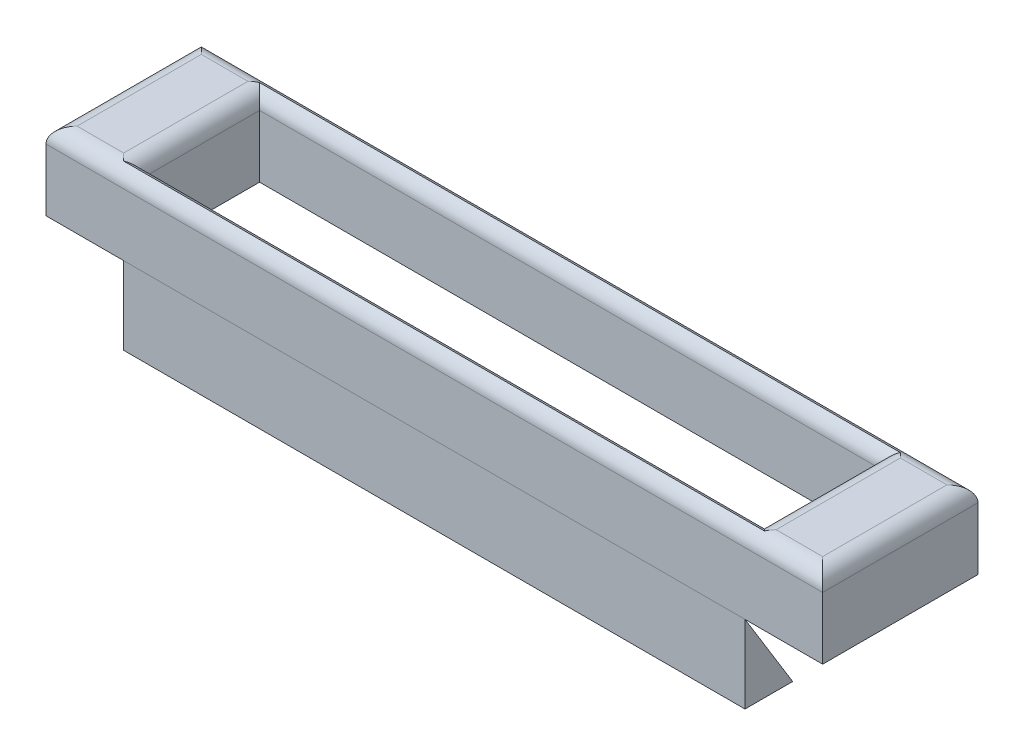
from build123d import *

# Parameters (mm, degrees)
BOSS_EXTRUDE1_DEPTH      = 10
BOSS_EXTRUDE1_DEPTH_BACK = 10
SKETCH1_W                = 100
SKETCH1_H                = 20
CUT_EXTRUDE1_DEPTH       = 100
SKETCH3_W                = 80
SKETCH3_H                = 15
CUT_EXTRUDE2_DEPTH       = 10
FILLET3_R                = 2
CUT_EXTRUDE4_DEPTH       = 10
CUT_EXTRUDE5_DEPTH       = 10
CUT_EXTRUDE6_DEPTH       = 80


with BuildPart() as part:
    # Sketch1 → Boss-Extrude1 (new, two sides: drawn at the far end of the back side and taken through both)
    with BuildSketch(Plane(origin=(0, 0, 0), x_dir=(1, 0, 0), z_dir=(0, 1, 0)).offset(-BOSS_EXTRUDE1_DEPTH_BACK)):
        with Locations((0, 8.804664723)):
            Rectangle(SKETCH1_W, SKETCH1_H)
    extrude(amount=BOSS_EXTRUDE1_DEPTH + BOSS_EXTRUDE1_DEPTH_BACK)

    # Sketch2 → Cut-Extrude1 (cut)
    with BuildSketch(Plane(origin=(50, 0, 0), x_dir=(0, 0, -1), z_dir=(1, 0, 0))):
        Polygon((-1.195335277, 0), (18.804664723, 0), (18.804664723, -10), align=None)
    extrude(amount=-CUT_EXTRUDE1_DEPTH, mode=Mode.SUBTRACT)


with BuildPart() as cut_extrude1_piece_1:
    # of the separate pieces the step leaves, piece 1, a body of its own (cut_extrude1_pieces)
    add(part.part.solids().sort_by_distance((-50, 10, 1.195335277))[0])

    # Sketch3 → Cut-Extrude2 (cut)
    with BuildSketch(Plane(origin=(0, 10, 0), x_dir=(1, 0, 0), z_dir=(0, 1, 0))):
        with Locations((0, 8.804664723)):
            Rectangle(SKETCH3_W, SKETCH3_H)
    extrude(amount=-CUT_EXTRUDE2_DEPTH, mode=Mode.SUBTRACT)

    # Fillet3
    # the kernel refuses this fillet: 2 mm, written as the material it takes off along each edge
    with BuildSketch(Plane(origin=(40, 10, -16.304664723), x_dir=(1, 0, 0), z_dir=(0, 0, 1)), Plane(origin=(-40, 10, -1.304664723), x_dir=(-1, 0, 0), z_dir=(0, 0, -1))) as fillet3_piece_1:
        with BuildLine():
            CenterArc((FILLET3_R, -FILLET3_R), FILLET3_R, 90, 90)
            Line((0, -FILLET3_R), (-FILLET3_R * 0.02, -FILLET3_R))
            Line((-FILLET3_R * 0.02, -FILLET3_R), (-FILLET3_R * 0.02, FILLET3_R * 0.02))
            Line((-FILLET3_R * 0.02, FILLET3_R * 0.02), (FILLET3_R, FILLET3_R * 0.02))
            Line((FILLET3_R, FILLET3_R * 0.02), (FILLET3_R, 0))
        make_face()
    extrude(amount=15, mode=Mode.SUBTRACT)
    with BuildSketch(Plane(origin=(-40, 10, -16.304664723), x_dir=(0, 0, -1), z_dir=(1, 0, 0)), Plane(origin=(40, 10, -1.304664723), x_dir=(0, 0, 1), z_dir=(-1, 0, 0))) as fillet3_piece_2:
        with BuildLine():
            CenterArc((FILLET3_R, -FILLET3_R), FILLET3_R, 90, 90)
            Line((0, -FILLET3_R), (-FILLET3_R * 0.02, -FILLET3_R))
            Line((-FILLET3_R * 0.02, -FILLET3_R), (-FILLET3_R * 0.02, FILLET3_R * 0.02))
            Line((-FILLET3_R * 0.02, FILLET3_R * 0.02), (FILLET3_R, FILLET3_R * 0.02))
            Line((FILLET3_R, FILLET3_R * 0.02), (FILLET3_R, 0))
        make_face()
    extrude(amount=80, mode=Mode.SUBTRACT)
    with BuildSketch(Plane(origin=(50, 10, 1.195335277), x_dir=(0, -1, 0), z_dir=(0, 0, -1)), Plane(origin=(-50, 10, -18.804664723), x_dir=(0, -1, 0), z_dir=(0, 0, 1))) as fillet3_piece_3:
        with BuildLine():
            CenterArc((FILLET3_R, FILLET3_R), FILLET3_R, 180, 90)
            Line((0, FILLET3_R), (-FILLET3_R * 0.02, FILLET3_R))
            Line((-FILLET3_R * 0.02, FILLET3_R), (-FILLET3_R * 0.02, -FILLET3_R * 0.02))
            Line((-FILLET3_R * 0.02, -FILLET3_R * 0.02), (FILLET3_R, -FILLET3_R * 0.02))
            Line((FILLET3_R, -FILLET3_R * 0.02), (FILLET3_R, 0))
        make_face()
    extrude(amount=20, mode=Mode.SUBTRACT)
    with BuildSketch(Plane(origin=(50, 10, -18.804664723), x_dir=(0, 0, 1), z_dir=(-1, 0, 0))) as fillet3_piece_4:
        with BuildLine():
            CenterArc((FILLET3_R, -FILLET3_R), FILLET3_R, 90, 90)
            Line((0, -FILLET3_R), (-FILLET3_R * 0.02, -FILLET3_R))
            Line((-FILLET3_R * 0.02, -FILLET3_R), (-FILLET3_R * 0.02, FILLET3_R * 0.02))
            Line((-FILLET3_R * 0.02, FILLET3_R * 0.02), (FILLET3_R, FILLET3_R * 0.02))
            Line((FILLET3_R, FILLET3_R * 0.02), (FILLET3_R, 0))
        make_face()
    extrude(amount=100, mode=Mode.SUBTRACT)
    with BuildSketch(Plane(origin=(-50, 10, 1.195335277), x_dir=(0, -1, 0), z_dir=(1, 0, 0))) as fillet3_piece_5:
        with BuildLine():
            CenterArc((FILLET3_R, FILLET3_R), FILLET3_R, 180, 90)
            Line((0, FILLET3_R), (-FILLET3_R * 0.02, FILLET3_R))
            Line((-FILLET3_R * 0.02, FILLET3_R), (-FILLET3_R * 0.02, -FILLET3_R * 0.02))
            Line((-FILLET3_R * 0.02, -FILLET3_R * 0.02), (FILLET3_R, -FILLET3_R * 0.02))
            Line((FILLET3_R, -FILLET3_R * 0.02), (FILLET3_R, 0))
        make_face()
    extrude(amount=100, mode=Mode.SUBTRACT)
    with BuildSketch(Plane(origin=(40, 10, -21.304664723), x_dir=(1, 0, 0), z_dir=(0, 0, 1))) as fillet3_piece_6a_section:
        with BuildLine():
            CenterArc((FILLET3_R, -FILLET3_R), FILLET3_R, 90, 90)
            Line((0, -FILLET3_R), (-FILLET3_R * 0.02, -FILLET3_R))
            Line((-FILLET3_R * 0.02, -FILLET3_R), (-FILLET3_R * 0.02, FILLET3_R * 0.02))
            Line((-FILLET3_R * 0.02, FILLET3_R * 0.02), (FILLET3_R, FILLET3_R * 0.02))
            Line((FILLET3_R, FILLET3_R * 0.02), (FILLET3_R, 0))
        make_face()
    fillet3_piece_6a = extrude(amount=20, mode=Mode.PRIVATE)
    fillet3_piece_6a = split(fillet3_piece_6a, bisect_by=Plane(origin=(40.452790229, 9.547209771, -16.304664723), z_dir=(0, 0, -1)), keep=Keep.TOP, mode=Mode.PRIVATE)
    with BuildSketch(Plane(origin=(-40, 10, -16.304664723), x_dir=(0, 0, -1), z_dir=(1, 0, 0))) as fillet3_piece_6b_section:
        with BuildLine():
            CenterArc((FILLET3_R, -FILLET3_R), FILLET3_R, 90, 90)
            Line((0, -FILLET3_R), (-FILLET3_R * 0.02, -FILLET3_R))
            Line((-FILLET3_R * 0.02, -FILLET3_R), (-FILLET3_R * 0.02, FILLET3_R * 0.02))
            Line((-FILLET3_R * 0.02, FILLET3_R * 0.02), (FILLET3_R, FILLET3_R * 0.02))
            Line((FILLET3_R, FILLET3_R * 0.02), (FILLET3_R, 0))
        make_face()
    fillet3_piece_6b = extrude(amount=85, mode=Mode.PRIVATE)
    fillet3_piece_6b = split(fillet3_piece_6b, bisect_by=Plane(origin=(40, 9.547209771, -16.757454952), z_dir=(1, 0, 0)), keep=Keep.TOP, mode=Mode.PRIVATE)
    fillet3_piece_6 = fillet3_piece_6a & fillet3_piece_6b
    add(fillet3_piece_6, mode=Mode.SUBTRACT)
    with BuildSketch(Plane(origin=(45, 10, -1.304664723), x_dir=(0, 0, 1), z_dir=(-1, 0, 0))) as fillet3_piece_7a_section:
        with BuildLine():
            CenterArc((FILLET3_R, -FILLET3_R), FILLET3_R, 90, 90)
            Line((0, -FILLET3_R), (-FILLET3_R * 0.02, -FILLET3_R))
            Line((-FILLET3_R * 0.02, -FILLET3_R), (-FILLET3_R * 0.02, FILLET3_R * 0.02))
            Line((-FILLET3_R * 0.02, FILLET3_R * 0.02), (FILLET3_R, FILLET3_R * 0.02))
            Line((FILLET3_R, FILLET3_R * 0.02), (FILLET3_R, 0))
        make_face()
    fillet3_piece_7a = extrude(amount=85, mode=Mode.PRIVATE)
    fillet3_piece_7a = split(fillet3_piece_7a, bisect_by=Plane(origin=(40, 9.547209771, -0.851874494), z_dir=(1, 0, 0)), keep=Keep.TOP, mode=Mode.PRIVATE)
    with BuildSketch(Plane(origin=(40, 10, -16.304664723), x_dir=(1, 0, 0), z_dir=(0, 0, 1))) as fillet3_piece_7b_section:
        with BuildLine():
            CenterArc((FILLET3_R, -FILLET3_R), FILLET3_R, 90, 90)
            Line((0, -FILLET3_R), (-FILLET3_R * 0.02, -FILLET3_R))
            Line((-FILLET3_R * 0.02, -FILLET3_R), (-FILLET3_R * 0.02, FILLET3_R * 0.02))
            Line((-FILLET3_R * 0.02, FILLET3_R * 0.02), (FILLET3_R, FILLET3_R * 0.02))
            Line((FILLET3_R, FILLET3_R * 0.02), (FILLET3_R, 0))
        make_face()
    fillet3_piece_7b = extrude(amount=20, mode=Mode.PRIVATE)
    fillet3_piece_7b = split(fillet3_piece_7b, bisect_by=Plane(origin=(40.452790229, 9.547209771, -1.304664723), z_dir=(0, 0, 1)), keep=Keep.TOP, mode=Mode.PRIVATE)
    fillet3_piece_7 = fillet3_piece_7a & fillet3_piece_7b
    add(fillet3_piece_7, mode=Mode.SUBTRACT)
    with BuildSketch(Plane(origin=(-40, 10, -1.304664723), x_dir=(-1, 0, 0), z_dir=(0, 0, -1))) as fillet3_piece_8a_section:
        with BuildLine():
            CenterArc((FILLET3_R, -FILLET3_R), FILLET3_R, 90, 90)
            Line((0, -FILLET3_R), (-FILLET3_R * 0.02, -FILLET3_R))
            Line((-FILLET3_R * 0.02, -FILLET3_R), (-FILLET3_R * 0.02, FILLET3_R * 0.02))
            Line((-FILLET3_R * 0.02, FILLET3_R * 0.02), (FILLET3_R, FILLET3_R * 0.02))
            Line((FILLET3_R, FILLET3_R * 0.02), (FILLET3_R, 0))
        make_face()
    fillet3_piece_8a = extrude(amount=20, mode=Mode.PRIVATE)
    fillet3_piece_8a = split(fillet3_piece_8a, bisect_by=Plane(origin=(-40.452790229, 9.547209771, -16.304664723), z_dir=(0, 0, -1)), keep=Keep.TOP, mode=Mode.PRIVATE)
    with BuildSketch(Plane(origin=(-45, 10, -16.304664723), x_dir=(0, 0, -1), z_dir=(1, 0, 0))) as fillet3_piece_8b_section:
        with BuildLine():
            CenterArc((FILLET3_R, -FILLET3_R), FILLET3_R, 90, 90)
            Line((0, -FILLET3_R), (-FILLET3_R * 0.02, -FILLET3_R))
            Line((-FILLET3_R * 0.02, -FILLET3_R), (-FILLET3_R * 0.02, FILLET3_R * 0.02))
            Line((-FILLET3_R * 0.02, FILLET3_R * 0.02), (FILLET3_R, FILLET3_R * 0.02))
            Line((FILLET3_R, FILLET3_R * 0.02), (FILLET3_R, 0))
        make_face()
    fillet3_piece_8b = extrude(amount=85, mode=Mode.PRIVATE)
    fillet3_piece_8b = split(fillet3_piece_8b, bisect_by=Plane(origin=(-40, 9.547209771, -16.757454952), z_dir=(-1, 0, 0)), keep=Keep.TOP, mode=Mode.PRIVATE)
    fillet3_piece_8 = fillet3_piece_8a & fillet3_piece_8b
    add(fillet3_piece_8, mode=Mode.SUBTRACT)
    with BuildSketch(Plane(origin=(-40, 10, 3.695335277), x_dir=(-1, 0, 0), z_dir=(0, 0, -1))) as fillet3_piece_9a_section:
        with BuildLine():
            CenterArc((FILLET3_R, -FILLET3_R), FILLET3_R, 90, 90)
            Line((0, -FILLET3_R), (-FILLET3_R * 0.02, -FILLET3_R))
            Line((-FILLET3_R * 0.02, -FILLET3_R), (-FILLET3_R * 0.02, FILLET3_R * 0.02))
            Line((-FILLET3_R * 0.02, FILLET3_R * 0.02), (FILLET3_R, FILLET3_R * 0.02))
            Line((FILLET3_R, FILLET3_R * 0.02), (FILLET3_R, 0))
        make_face()
    fillet3_piece_9a = extrude(amount=20, mode=Mode.PRIVATE)
    fillet3_piece_9a = split(fillet3_piece_9a, bisect_by=Plane(origin=(-40.452790229, 9.547209771, -1.304664723), z_dir=(0, 0, 1)), keep=Keep.TOP, mode=Mode.PRIVATE)
    with BuildSketch(Plane(origin=(40, 10, -1.304664723), x_dir=(0, 0, 1), z_dir=(-1, 0, 0))) as fillet3_piece_9b_section:
        with BuildLine():
            CenterArc((FILLET3_R, -FILLET3_R), FILLET3_R, 90, 90)
            Line((0, -FILLET3_R), (-FILLET3_R * 0.02, -FILLET3_R))
            Line((-FILLET3_R * 0.02, -FILLET3_R), (-FILLET3_R * 0.02, FILLET3_R * 0.02))
            Line((-FILLET3_R * 0.02, FILLET3_R * 0.02), (FILLET3_R, FILLET3_R * 0.02))
            Line((FILLET3_R, FILLET3_R * 0.02), (FILLET3_R, 0))
        make_face()
    fillet3_piece_9b = extrude(amount=85, mode=Mode.PRIVATE)
    fillet3_piece_9b = split(fillet3_piece_9b, bisect_by=Plane(origin=(-40, 9.547209771, -0.851874494), z_dir=(-1, 0, 0)), keep=Keep.TOP, mode=Mode.PRIVATE)
    fillet3_piece_9 = fillet3_piece_9a & fillet3_piece_9b
    add(fillet3_piece_9, mode=Mode.SUBTRACT)
    with BuildSketch(Plane(origin=(-50, 10, 1.195335277), x_dir=(0, -1, 0), z_dir=(1, 0, 0))) as fillet3_piece_10a_section:
        with BuildLine():
            CenterArc((FILLET3_R, FILLET3_R), FILLET3_R, 180, 90)
            Line((0, FILLET3_R), (-FILLET3_R * 0.02, FILLET3_R))
            Line((-FILLET3_R * 0.02, FILLET3_R), (-FILLET3_R * 0.02, -FILLET3_R * 0.02))
            Line((-FILLET3_R * 0.02, -FILLET3_R * 0.02), (FILLET3_R, -FILLET3_R * 0.02))
            Line((FILLET3_R, -FILLET3_R * 0.02), (FILLET3_R, 0))
        make_face()
    fillet3_piece_10a = extrude(amount=105, mode=Mode.PRIVATE)
    fillet3_piece_10a = split(fillet3_piece_10a, bisect_by=Plane(origin=(50, 9.547209771, 0.742545048), z_dir=(1, 0, 0)), keep=Keep.TOP, mode=Mode.PRIVATE)
    with BuildSketch(Plane(origin=(50, 10, 6.195335277), x_dir=(0, -1, 0), z_dir=(0, 0, -1))) as fillet3_piece_10b_section:
        with BuildLine():
            CenterArc((FILLET3_R, FILLET3_R), FILLET3_R, 180, 90)
            Line((0, FILLET3_R), (-FILLET3_R * 0.02, FILLET3_R))
            Line((-FILLET3_R * 0.02, FILLET3_R), (-FILLET3_R * 0.02, -FILLET3_R * 0.02))
            Line((-FILLET3_R * 0.02, -FILLET3_R * 0.02), (FILLET3_R, -FILLET3_R * 0.02))
            Line((FILLET3_R, -FILLET3_R * 0.02), (FILLET3_R, 0))
        make_face()
    fillet3_piece_10b = extrude(amount=25, mode=Mode.PRIVATE)
    fillet3_piece_10b = split(fillet3_piece_10b, bisect_by=Plane(origin=(49.547209771, 9.547209771, 1.195335277), z_dir=(0, 0, 1)), keep=Keep.TOP, mode=Mode.PRIVATE)
    fillet3_piece_10 = fillet3_piece_10a & fillet3_piece_10b
    add(fillet3_piece_10, mode=Mode.SUBTRACT)
    with BuildSketch(Plane(origin=(50, 10, 1.195335277), x_dir=(0, -1, 0), z_dir=(0, 0, -1))) as fillet3_piece_11a_section:
        with BuildLine():
            CenterArc((FILLET3_R, FILLET3_R), FILLET3_R, 180, 90)
            Line((0, FILLET3_R), (-FILLET3_R * 0.02, FILLET3_R))
            Line((-FILLET3_R * 0.02, FILLET3_R), (-FILLET3_R * 0.02, -FILLET3_R * 0.02))
            Line((-FILLET3_R * 0.02, -FILLET3_R * 0.02), (FILLET3_R, -FILLET3_R * 0.02))
            Line((FILLET3_R, -FILLET3_R * 0.02), (FILLET3_R, 0))
        make_face()
    fillet3_piece_11a = extrude(amount=25, mode=Mode.PRIVATE)
    fillet3_piece_11a = split(fillet3_piece_11a, bisect_by=Plane(origin=(49.547209771, 9.547209771, -18.804664723), z_dir=(0, 0, -1)), keep=Keep.TOP, mode=Mode.PRIVATE)
    with BuildSketch(Plane(origin=(55, 10, -18.804664723), x_dir=(0, 0, 1), z_dir=(-1, 0, 0))) as fillet3_piece_11b_section:
        with BuildLine():
            CenterArc((FILLET3_R, -FILLET3_R), FILLET3_R, 90, 90)
            Line((0, -FILLET3_R), (-FILLET3_R * 0.02, -FILLET3_R))
            Line((-FILLET3_R * 0.02, -FILLET3_R), (-FILLET3_R * 0.02, FILLET3_R * 0.02))
            Line((-FILLET3_R * 0.02, FILLET3_R * 0.02), (FILLET3_R, FILLET3_R * 0.02))
            Line((FILLET3_R, FILLET3_R * 0.02), (FILLET3_R, 0))
        make_face()
    fillet3_piece_11b = extrude(amount=105, mode=Mode.PRIVATE)
    fillet3_piece_11b = split(fillet3_piece_11b, bisect_by=Plane(origin=(50, 9.547209771, -18.351874494), z_dir=(1, 0, 0)), keep=Keep.TOP, mode=Mode.PRIVATE)
    fillet3_piece_11 = fillet3_piece_11a & fillet3_piece_11b
    add(fillet3_piece_11, mode=Mode.SUBTRACT)
    with BuildSketch(Plane(origin=(-50, 10, -23.804664723), x_dir=(0, -1, 0), z_dir=(0, 0, 1))) as fillet3_piece_12a_section:
        with BuildLine():
            CenterArc((FILLET3_R, FILLET3_R), FILLET3_R, 180, 90)
            Line((0, FILLET3_R), (-FILLET3_R * 0.02, FILLET3_R))
            Line((-FILLET3_R * 0.02, FILLET3_R), (-FILLET3_R * 0.02, -FILLET3_R * 0.02))
            Line((-FILLET3_R * 0.02, -FILLET3_R * 0.02), (FILLET3_R, -FILLET3_R * 0.02))
            Line((FILLET3_R, -FILLET3_R * 0.02), (FILLET3_R, 0))
        make_face()
    fillet3_piece_12a = extrude(amount=25, mode=Mode.PRIVATE)
    fillet3_piece_12a = split(fillet3_piece_12a, bisect_by=Plane(origin=(-49.547209771, 9.547209771, -18.804664723), z_dir=(0, 0, -1)), keep=Keep.TOP, mode=Mode.PRIVATE)
    with BuildSketch(Plane(origin=(50, 10, -18.804664723), x_dir=(0, 0, 1), z_dir=(-1, 0, 0))) as fillet3_piece_12b_section:
        with BuildLine():
            CenterArc((FILLET3_R, -FILLET3_R), FILLET3_R, 90, 90)
            Line((0, -FILLET3_R), (-FILLET3_R * 0.02, -FILLET3_R))
            Line((-FILLET3_R * 0.02, -FILLET3_R), (-FILLET3_R * 0.02, FILLET3_R * 0.02))
            Line((-FILLET3_R * 0.02, FILLET3_R * 0.02), (FILLET3_R, FILLET3_R * 0.02))
            Line((FILLET3_R, FILLET3_R * 0.02), (FILLET3_R, 0))
        make_face()
    fillet3_piece_12b = extrude(amount=105, mode=Mode.PRIVATE)
    fillet3_piece_12b = split(fillet3_piece_12b, bisect_by=Plane(origin=(-50, 9.547209771, -18.351874494), z_dir=(-1, 0, 0)), keep=Keep.TOP, mode=Mode.PRIVATE)
    fillet3_piece_12 = fillet3_piece_12a & fillet3_piece_12b
    add(fillet3_piece_12, mode=Mode.SUBTRACT)
    with BuildSketch(Plane(origin=(-55, 10, 1.195335277), x_dir=(0, -1, 0), z_dir=(1, 0, 0))) as fillet3_piece_13a_section:
        with BuildLine():
            CenterArc((FILLET3_R, FILLET3_R), FILLET3_R, 180, 90)
            Line((0, FILLET3_R), (-FILLET3_R * 0.02, FILLET3_R))
            Line((-FILLET3_R * 0.02, FILLET3_R), (-FILLET3_R * 0.02, -FILLET3_R * 0.02))
            Line((-FILLET3_R * 0.02, -FILLET3_R * 0.02), (FILLET3_R, -FILLET3_R * 0.02))
            Line((FILLET3_R, -FILLET3_R * 0.02), (FILLET3_R, 0))
        make_face()
    fillet3_piece_13a = extrude(amount=105, mode=Mode.PRIVATE)
    fillet3_piece_13a = split(fillet3_piece_13a, bisect_by=Plane(origin=(-50, 9.547209771, 0.742545048), z_dir=(-1, 0, 0)), keep=Keep.TOP, mode=Mode.PRIVATE)
    with BuildSketch(Plane(origin=(-50, 10, -18.804664723), x_dir=(0, -1, 0), z_dir=(0, 0, 1))) as fillet3_piece_13b_section:
        with BuildLine():
            CenterArc((FILLET3_R, FILLET3_R), FILLET3_R, 180, 90)
            Line((0, FILLET3_R), (-FILLET3_R * 0.02, FILLET3_R))
            Line((-FILLET3_R * 0.02, FILLET3_R), (-FILLET3_R * 0.02, -FILLET3_R * 0.02))
            Line((-FILLET3_R * 0.02, -FILLET3_R * 0.02), (FILLET3_R, -FILLET3_R * 0.02))
            Line((FILLET3_R, -FILLET3_R * 0.02), (FILLET3_R, 0))
        make_face()
    fillet3_piece_13b = extrude(amount=25, mode=Mode.PRIVATE)
    fillet3_piece_13b = split(fillet3_piece_13b, bisect_by=Plane(origin=(-49.547209771, 9.547209771, 1.195335277), z_dir=(0, 0, 1)), keep=Keep.TOP, mode=Mode.PRIVATE)
    fillet3_piece_13 = fillet3_piece_13a & fillet3_piece_13b
    add(fillet3_piece_13, mode=Mode.SUBTRACT)


with BuildPart() as cut_extrude1_piece_2:
    # of the separate pieces the step leaves, piece 2, a body of its own (cut_extrude1_pieces)
    add(part.part.solids().sort_by_distance((-50, -10, 1.195335277))[0])

    # Sketch4 → Cut-Extrude4 (cut)
    with BuildSketch(Plane.ZY.offset(50)):
        Polygon((1.195335277, -10), (1.195335277, 0), (-18.804664723, -10), align=None)
    extrude(amount=-CUT_EXTRUDE4_DEPTH, mode=Mode.SUBTRACT)

    # Sketch5 → Cut-Extrude5 (cut)
    with BuildSketch(Plane(origin=(50, 0, 0), x_dir=(0, 0, -1), z_dir=(1, 0, 0))):
        Polygon((-1.195335277, -10), (-1.195335277, 0), (18.804664723, -10), align=None)
    extrude(amount=-CUT_EXTRUDE5_DEPTH, mode=Mode.SUBTRACT)

    # Sketch6 → Cut-Extrude6 (cut)
    with BuildSketch(Plane.ZY.offset(40)):
        Polygon((1.195335277, 0), (-4.944370746, -10), (-18.804664723, -10), align=None)
    extrude(amount=-CUT_EXTRUDE6_DEPTH, mode=Mode.SUBTRACT)


solid = Compound([cut_extrude1_piece_1.part, cut_extrude1_piece_2.part])
